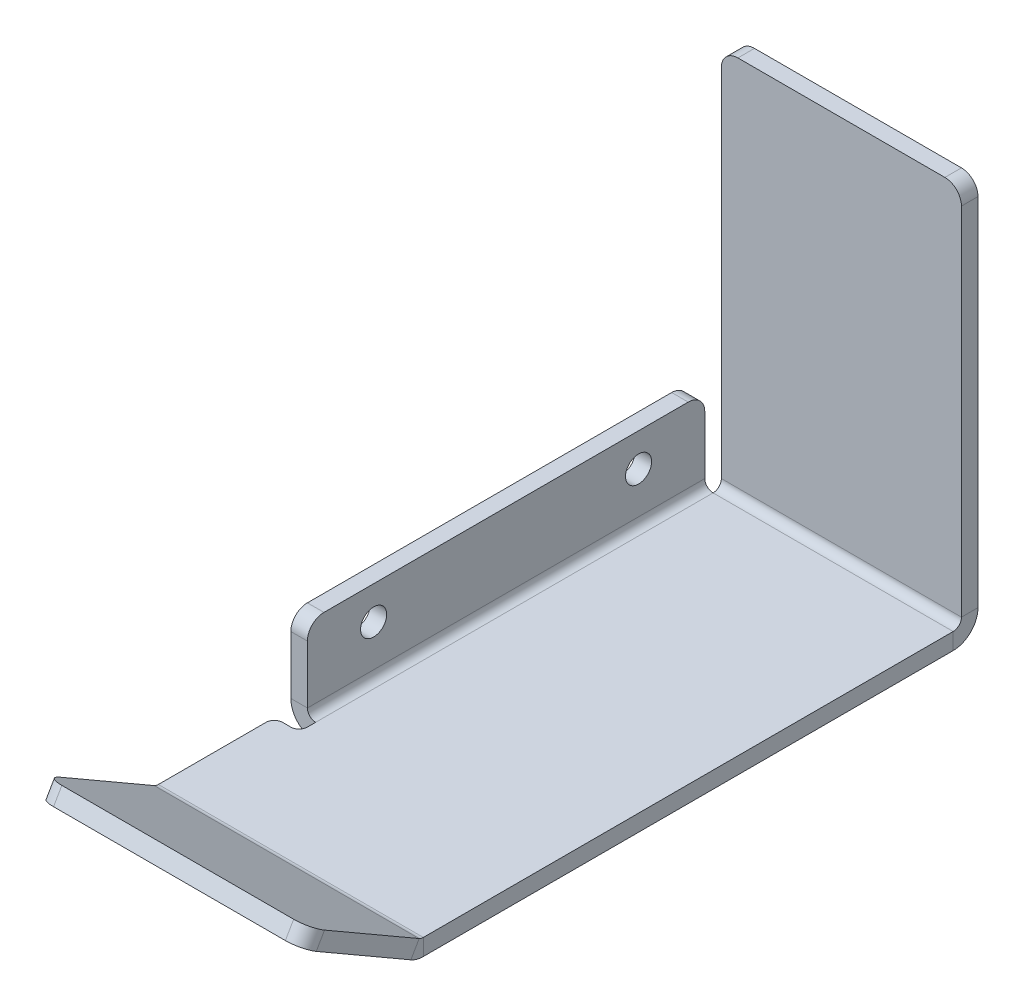
from build123d import *

# Parameters (mm, degrees)
BASE_FLANGE1_DEPTH    = 38.1
TAB1_DEPTH            = 3.175
EDGE_FLANGE1_DEPTH    = 50.8
FILLET2_R             = 1.5875
M6X1_0_TAPPED_HOLE1_D = 5
EDGE_FLANGE2_DEPTH    = 46.0375
FILLET1_R             = 3.175


# Sheet-metal steps are written as plain solids
with BuildPart() as part:
    # Sketch1 → Base-Flange1 (new, symmetric)
    with BuildSketch(Plane.XY):
        with BuildLine():
            Line((0, 19.05), (0, 4.7625))
            ThreePointArc((0, 4.7625), (1.394903955, 1.394903955), (4.7625, 0))
            Line((4.7625, 0), (50.8, 0))
            Line((50.8, 0), (50.8, 3.175))
            Line((50.8, 3.175), (4.7625, 3.175))
            ThreePointArc((4.7625, 3.175), (3.639967985, 3.639967985), (3.175, 4.7625))
            Line((3.175, 4.7625), (3.175, 19.05))
            Line((3.175, 19.05), (0, 19.05))
        make_face()
    extrude(amount=BASE_FLANGE1_DEPTH, both=True)

    # Sketch2 → Tab1 (add)
    with BuildSketch(Plane.XZ):
        Polygon((50.8, 38.1), (4.7625, 38.1), (4.7625, 41.275), (0, 41.275), (0, 63.5), (50.8, 63.5), align=None)
    extrude(amount=-TAB1_DEPTH)

    # Edge-Flange1 section (across the edge) → Edge-Flange1 (add)
    with BuildSketch(Plane(origin=(0, 3.175, 63.925369343), x_dir=(0, 0.8660254037844416, -0.49999999999999495), z_dir=(1, 0, 0))):
        with BuildLine():
            Line((-3.175, 0.425369343), (-3.175, 24.549261314))
            Line((-3.175, 24.549261314), (0, 24.549261314))
            Line((0, 24.549261314), (0, 0.425369343))
            ThreePointArc((0, 0.425369343), (0.054092751, 0.014494109), (0.212684671, -0.368380657))
            Line((0.212684671, -0.368380657), (-2.536945986, -1.955880657))
            ThreePointArc((-2.536945986, -1.955880657), (-3.012721748, -0.807256359), (-3.175, 0.425369343))
        make_face()
    extrude(amount=EDGE_FLANGE1_DEPTH)

    # Fillet2
    fillet2_edges = [part.edges().sort_by_distance(p)[0] for p in [
        (4.7625, 1.5875, 41.275),
        (0, 1.5875, 41.275),
    ]]
    fillet(fillet2_edges, radius=FILLET2_R)

    # M6x1.0 Tapped Hole1 (through all)
    with Locations(Plane(origin=(3.175, 0, 0), x_dir=(0, 0, -1), z_dir=(1, 0, 0))):
        with Locations((-25.4, 12.7), (25.4, 12.7)):
            Hole(M6X1_0_TAPPED_HOLE1_D / 2)

    # Edge-Flange2 section (across the edge) → Edge-Flange2 (add)
    with BuildSketch(Plane(origin=(50.8, 3.175, -39.6875), x_dir=(0, 0, 1), z_dir=(-1, 0, 0))):
        with BuildLine():
            Line((-3.175, 1.5875), (-3.175, 73.025))
            Line((-3.175, 73.025), (0, 73.025))
            Line((0, 73.025), (0, 1.5875))
            ThreePointArc((0, 1.5875), (0.464967985, 0.464967985), (1.5875, 0))
            Line((1.5875, 0), (1.5875, -3.175))
            ThreePointArc((1.5875, -3.175), (-1.780096045, -1.780096045), (-3.175, 1.5875))
        make_face()
    extrude(amount=EDGE_FLANGE2_DEPTH)

    # Fillet1
    fillet1_edges = [part.edges().sort_by_distance(p)[0] for p in [
        (4.7625, 76.2, -41.275),
        (1.5875, 19.05, 38.1),
        (0, 14.074815329, 85.979403285),
        (50.8, 14.074815329, 85.979403285),
        (1.5875, 19.05, -38.1),
        (50.8, 76.2, -41.275),
    ]]
    fillet(fillet1_edges, radius=FILLET1_R)


solid = part.part
